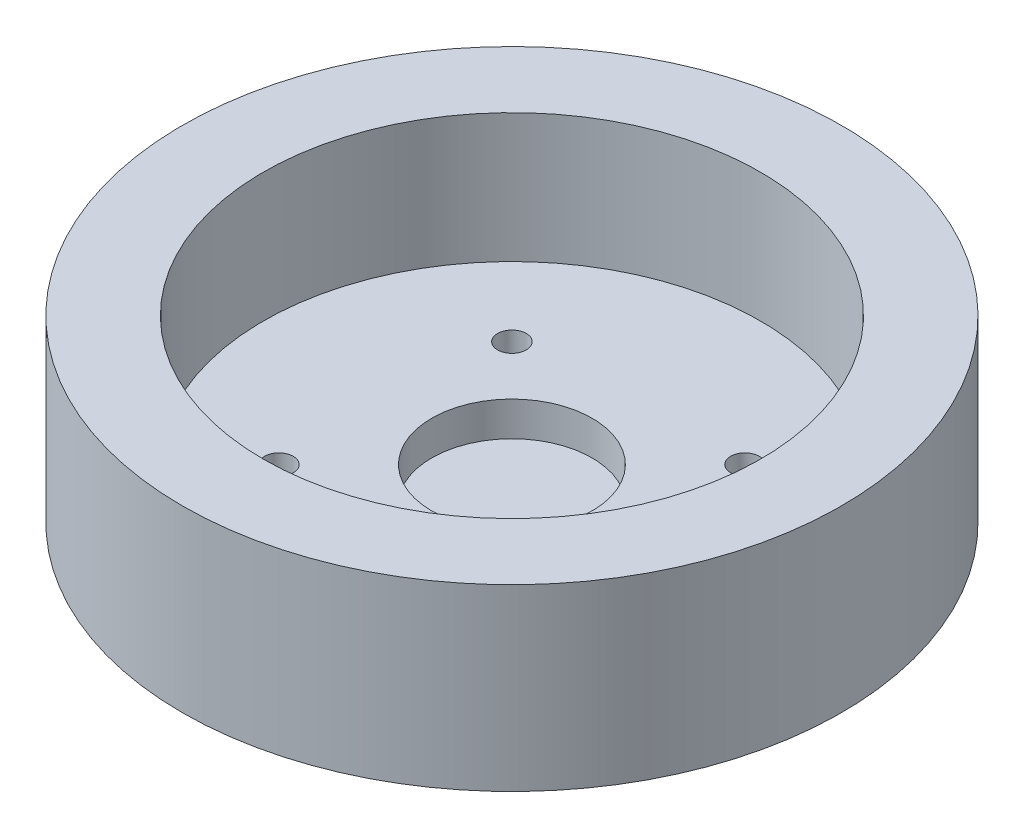
from build123d import *

# Parameters (mm, degrees)
SKETCH_1_R          = 17.35
SKETCH_1_R_2        = 5.6
EXTRUDE_1_DEPTH     = 3.5
SKETCH_3_R          = 23
SKETCH_3_R_2        = 17.35
EXTRUDE_3_DEPTH     = 12.5
SKETCH_4_R          = 5.6
EXTRUDE_4_DEPTH     = 1.1
SKETCH_6_R          = 1
CUT_EXTRUDE_3_DEPTH = 5
SKETCH_8_R          = 1.91
CUT_EXTRUDE_4_DEPTH = 1.9


with BuildPart() as part:
    # 草图1 → 凸台-拉伸1 (new body)
    with BuildSketch(Plane(origin=(0, 0, 0), x_dir=(1, 0, 0), z_dir=(0, 1, 0))):
        Circle(SKETCH_1_R)
        Circle(SKETCH_1_R_2, mode=Mode.SUBTRACT)
    extrude(amount=EXTRUDE_1_DEPTH)

    # 草图3 → 凸台-拉伸3 (add)
    with BuildSketch(Plane(origin=(0, 0, 0), x_dir=(1, 0, 0), z_dir=(0, 1, 0))):
        Circle(SKETCH_3_R)
        Circle(SKETCH_3_R_2, mode=Mode.SUBTRACT)
    extrude(amount=EXTRUDE_3_DEPTH)

    # 草图4 → 凸台-拉伸4 (add)
    with BuildSketch(Plane(origin=(0, 0, 0), x_dir=(1, 0, 0), z_dir=(0, 1, 0))):
        Circle(SKETCH_4_R)
    extrude(amount=EXTRUDE_4_DEPTH)

    # 草图6 → 切除-拉伸3 (cut, symmetric)
    with BuildSketch(Plane(origin=(0, 0, 0), x_dir=(1, 0, 0), z_dir=(0, 1, 0))):
        with Locations((8.131727984, 8.131727984)):
            Circle(SKETCH_6_R)
        with Locations((7.424621202, -7.424621202)):
            Circle(SKETCH_6_R)
        with Locations((-8.131727984, -8.131727984)):
            Circle(SKETCH_6_R)
        with Locations((-7.424621202, 7.424621202)):
            Circle(SKETCH_6_R)
    extrude(amount=CUT_EXTRUDE_3_DEPTH, both=True, mode=Mode.SUBTRACT)

    # 草图8 → 切除-拉伸4 (cut)
    with BuildSketch(Plane.XZ):
        with Locations((-8.131727984, 8.131727984)):
            Circle(SKETCH_8_R)
        with Locations((7.424621202, 7.424621202)):
            Circle(SKETCH_8_R)
        with Locations((-7.424621202, -7.424621202)):
            Circle(SKETCH_8_R)
        with Locations((8.131727984, -8.131727984)):
            Circle(SKETCH_8_R)
    extrude(amount=-CUT_EXTRUDE_4_DEPTH, mode=Mode.SUBTRACT)


solid = part.part
